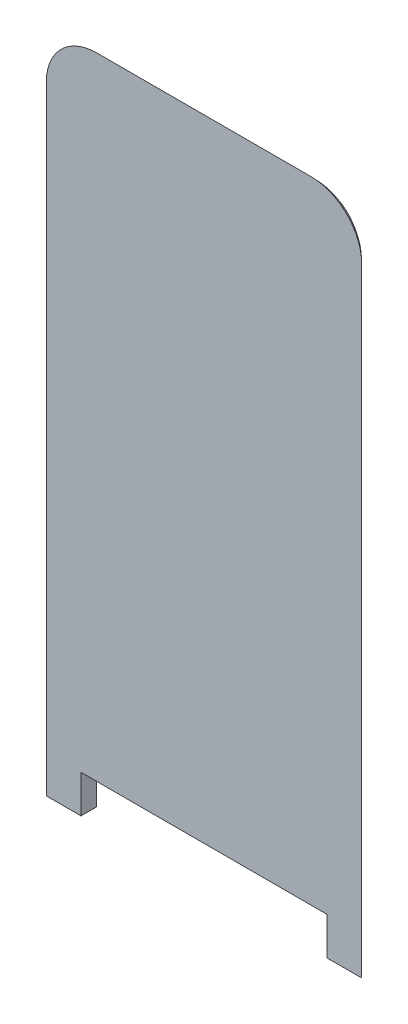
from build123d import *

# Parameters (mm, degrees)
BOSS_EXTRUDE1_DEPTH = 2.5
FILLET1_R           = 8
FILLET2_R           = 8


with BuildPart() as part:
    # Sketch1 → Boss-Extrude1 (new body)
    with BuildSketch(Plane.XY):
        Polygon((19.5, -53), (25, -53), (25, 53), (-25, 53), (-25, -53), (-19.5, -53), (-19.5, -47.017253966), (19.5, -47.017253966), align=None)
    extrude(amount=BOSS_EXTRUDE1_DEPTH)

    # Fillet1
    fillet1_edges = [part.edges().sort_by_distance(p)[0] for p in [
        (-25, 53, 1.25),
        (25, 53, 1.25),
    ]]
    fillet(fillet1_edges, radius=FILLET1_R)

    # Fillet2
    # the kernel refuses this fillet: 8 mm, written as the material it takes off along each edge
    with BuildSketch(Plane(origin=(-25, 45, 0), x_dir=(1, 0, 0), z_dir=(0, -1, 0))) as fillet2_piece_1:
        with BuildLine():
            CenterArc((5.809475019, 8), FILLET2_R, 223.432536558, 46.567463442)
            Line((0, 2.5), (-0.1161895, 2.39))
            ThreePointArc((-0.1161895, 2.39), (-0.16, 1.25), (-0.16, 0))
            Line((-0.16, 0), (0, -0.16))
            Line((0, -0.16), (5.809475019, -0.16))
            Line((5.809475019, -0.16), (5.809475019, 0))
        make_face()
    extrude(amount=112.523687548, mode=Mode.SUBTRACT)
    with BuildSketch(Plane(origin=(-17, 45, 0), x_dir=(0, 1, 0), z_dir=(1, 0, 0))) as fillet2_piece_2:
        with BuildLine():
            CenterArc((2.190524981, 8), FILLET2_R, 270, 46.567463442)
            Line((8, 2.5), (8.1161895, 2.39))
            ThreePointArc((8.1161895, 2.39), (8.16, 1.25), (8.16, 0))
            Line((8.16, 0), (8, -0.16))
            Line((8, -0.16), (2.190524981, -0.16))
            Line((2.190524981, -0.16), (2.190524981, 0))
        make_face()
    revolve(axis=Axis((-17, 45, 0), (0, 0, 1)), revolution_arc=90, mode=Mode.SUBTRACT)
    with BuildSketch(Plane(origin=(17, 53, 0), x_dir=(0, -1, 0), z_dir=(-1, 0, 0))) as fillet2_piece_3:
        with BuildLine():
            CenterArc((5.809475019, 8), FILLET2_R, 223.432536558, 46.567463442)
            Line((0, 2.5), (-0.1161895, 2.39))
            ThreePointArc((-0.1161895, 2.39), (-0.16, 1.25), (-0.16, 0))
            Line((-0.16, 0), (0, -0.16))
            Line((0, -0.16), (5.809475019, -0.16))
            Line((5.809475019, -0.16), (5.809475019, 0))
        make_face()
    extrude(amount=34, mode=Mode.SUBTRACT)
    with BuildSketch(Plane(origin=(17, 45, 0), x_dir=(1, 0, 0), z_dir=(0, -1, 0))) as fillet2_piece_4:
        with BuildLine():
            CenterArc((2.190524981, 8), FILLET2_R, 270, 46.567463442)
            Line((8, 2.5), (8.1161895, 2.39))
            ThreePointArc((8.1161895, 2.39), (8.16, 1.25), (8.16, 0))
            Line((8.16, 0), (8, -0.16))
            Line((8, -0.16), (2.190524981, -0.16))
            Line((2.190524981, -0.16), (2.190524981, 0))
        make_face()
    revolve(axis=Axis((17, 45, 0), (0, 0, 1)), revolution_arc=90, mode=Mode.SUBTRACT)
    with BuildSketch(Plane(origin=(25, -67.523687548, 0), x_dir=(0, 0, 1), z_dir=(0, 1, 0))) as fillet2_piece_5:
        with BuildLine():
            CenterArc((8, -5.809475019), FILLET2_R, 133.432536558, 46.567463442)
            Line((0, -5.809475019), (-0.16, -5.809475019))
            Line((-0.16, -5.809475019), (-0.16, 0))
            Line((-0.16, 0), (0, 0.16))
            ThreePointArc((0, 0.16), (1.25, 0.16), (2.39, 0.1161895))
            Line((2.39, 0.1161895), (2.5, 0))
        make_face()
    extrude(amount=112.523687548, mode=Mode.SUBTRACT)


solid = part.part
